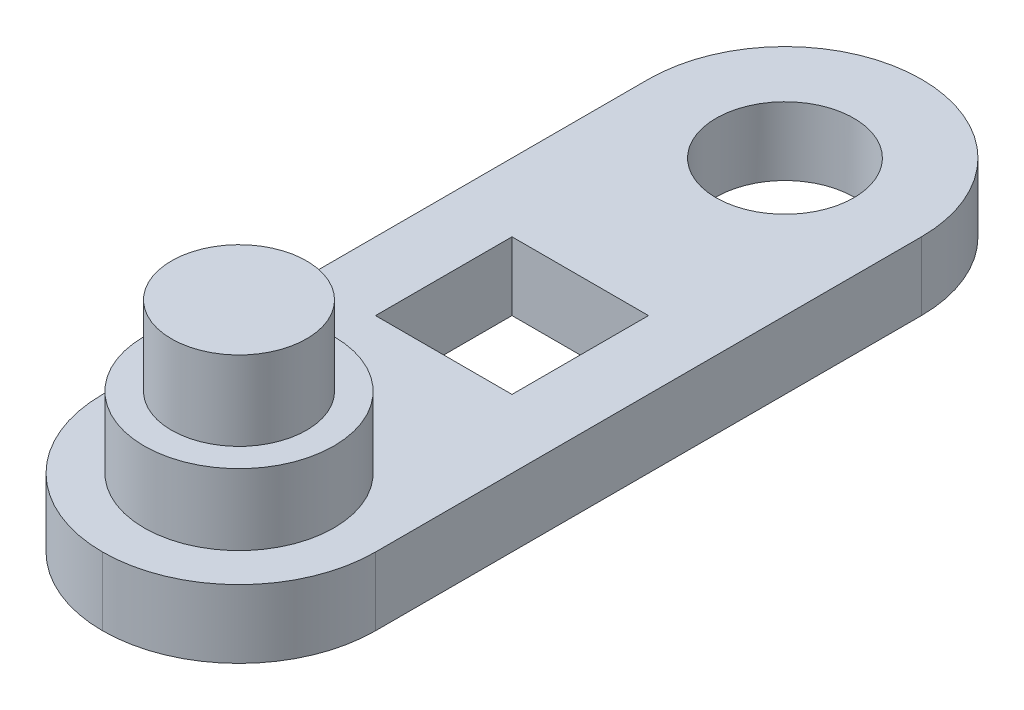
from build123d import *

# Parameters (mm, degrees)
SKETCH1_W           = 20
SKETCH1_H           = 60
BOSS_EXTRUDE1_DEPTH = 5
FILLET1_R           = 10
SKETCH2_R           = 4.95
BOSS_EXTRUDE2_DEPTH = 11
SKETCH2_4_R         = 5.05
CUT_EXTRUDE1_DEPTH  = 5
SKETCH4_W           = 10
SKETCH4_H           = 10
CUT_EXTRUDE2_DEPTH  = 5
SKETCH5_R           = 6.95
BOSS_EXTRUDE3_DEPTH = 5.2


with BuildPart() as part:
    # Sketch1 → Boss-Extrude1 (new body)
    with BuildSketch(Plane(origin=(0, 0, 0), x_dir=(1, 0, 0), z_dir=(0, 1, 0))):
        with Locations((-13.333333333, -1.025641026)):
            Rectangle(SKETCH1_W, SKETCH1_H)
    extrude(amount=BOSS_EXTRUDE1_DEPTH)

    # Fillet1
    fillet1_edges = [part.edges().sort_by_distance(p)[0] for p in [
        (-23.333333333, 2.5, -28.974358974),
        (-3.333333333, 2.5, -28.974358974),
        (-23.333333333, 2.5, 31.025641026),
        (-3.333333333, 2.5, 31.025641026),
    ]]
    fillet(fillet1_edges, radius=FILLET1_R - 0.0001)  # a hair under: the kernel refuses the full size

    # Sketch2 → Boss-Extrude2 (add)
    with BuildSketch(Plane(origin=(0, 5, 0), x_dir=(1, 0, 0), z_dir=(0, 1, 0))):
        with Locations(Location((-13.333333333, -21.025641026, 0), (0, 0, 90))):
            Circle(SKETCH2_R)
    extrude(amount=BOSS_EXTRUDE2_DEPTH)

    # Sketch2<4> → Cut-Extrude1 (cut)
    with BuildSketch(Plane(origin=(0, 5, 0), x_dir=(1, 0, 0), z_dir=(0, 1, 0))):
        with Locations(Location((-13.333333333, 18.974358974, 0), (0, 0, 270))):
            Circle(SKETCH2_4_R)
    extrude(amount=-CUT_EXTRUDE1_DEPTH, mode=Mode.SUBTRACT)

    # Sketch4 → Cut-Extrude2 (cut)
    with BuildSketch(Plane(origin=(0, 5, 0), x_dir=(1, 0, 0), z_dir=(0, 1, 0))):
        with Locations((-13.333333333, -1.025641026)):
            Rectangle(SKETCH4_W, SKETCH4_H)
    extrude(amount=-CUT_EXTRUDE2_DEPTH, mode=Mode.SUBTRACT)

    # Sketch5 → Boss-Extrude3 (add)
    with BuildSketch(Plane(origin=(0, 5, 0), x_dir=(1, 0, 0), z_dir=(0, 1, 0))):
        with Locations(Location((-13.333333333, -21.025641026, 0), (0, 0, 90))):
            Circle(SKETCH5_R)
    extrude(amount=BOSS_EXTRUDE3_DEPTH)


solid = part.part
